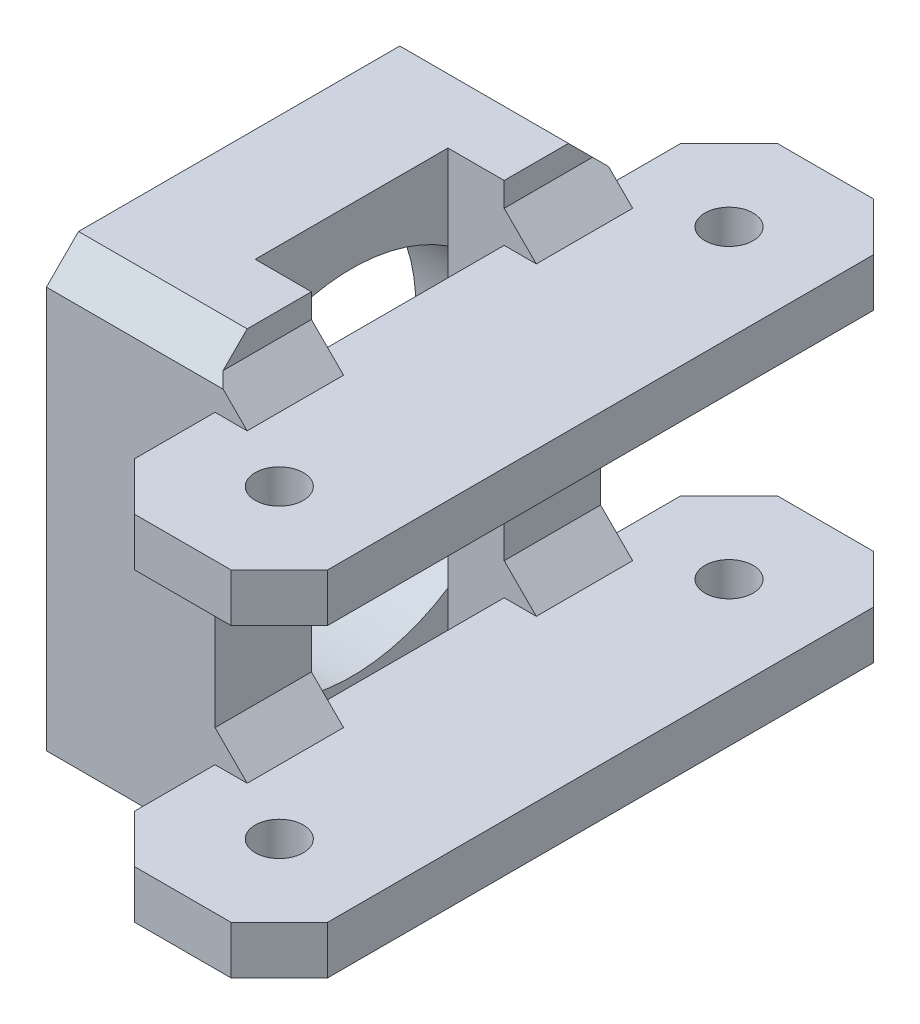
from build123d import *

# Parameters (mm, degrees)
SKETCH1_R           = 1.5
BOSS_EXTRUDE1_DEPTH = 3
BOSS_EXTRUDE2_START = 22.5
SKETCH2_W           = 3.5
SKETCH2_H           = 6
BOSS_EXTRUDE2_DEPTH = 29
CHAMFER2_SIZE       = 2
SKETCH3_W           = 24
SKETCH3_H           = 29
SKETCH3_R           = 11
BOSS_EXTRUDE4_DEPTH = 7
CHAMFER3_SIZE       = 2


# Read off the part's stored shape, not the designer's step: Mirror1
with BuildPart() as part:
    # Sketch1 → Boss-Extrude1 (new body)
    with BuildSketch(Plane(origin=(0, 0, 0), x_dir=(1, 0, 0), z_dir=(0, 1, 0))):
        Polygon((-6, 17), (-3, 20), (3, 20), (6, 17), (6, -17), (3, -20), (-3, -20), (-6, -17), align=None)
        with Locations(Location((0, 14, 0), (0, 0, 270))):
            Circle(SKETCH1_R, mode=Mode.SUBTRACT)
        with Locations(Location((0, -14, 0), (0, 0, 270))):
            Circle(SKETCH1_R, mode=Mode.SUBTRACT)
    extrude(amount=BOSS_EXTRUDE1_DEPTH)

    # Sketch2 → Boss-Extrude2 (add)
    with BuildSketch(Plane(origin=(0, 3, 0), x_dir=(1, 0, 0), z_dir=(0, 1, 0)).offset(BOSS_EXTRUDE2_START)):
        with Locations((-7.75, 9)):
            Rectangle(SKETCH2_W, SKETCH2_H)
        with Locations((-7.75, -9)):
            Rectangle(SKETCH2_W, SKETCH2_H)
    extrude(amount=-BOSS_EXTRUDE2_DEPTH)

    # Chamfer2
    chamfer2_edges = [part.edges().sort_by_distance(p)[0] for p in [
        (-6, 0, -9),
        (-6, 0, 9),
        (-6, 3, -9),
        (-6, 3, 9),
    ]]
    chamfer(chamfer2_edges, length=CHAMFER2_SIZE)

    # Sketch3 → Boss-Extrude4 (add)
    with BuildSketch(Plane.ZY.offset(9.5)):
        with Locations((0, 11)):
            Rectangle(SKETCH3_W, SKETCH3_H)
        with Locations(Location((0, 11, 0), (0, 0, 236.944268849))):
            Circle(SKETCH3_R, mode=Mode.SUBTRACT)
    extrude(amount=BOSS_EXTRUDE4_DEPTH)

    # Chamfer3
    chamfer3_edges = [part.edges().sort_by_distance(p)[0] for p in [
        (-11.25, 25.5, -12),
        (-11.25, -3.5, -12),
        (-11.25, -3.5, 12),
        (-11.25, 25.5, 12),
    ]]
    chamfer(chamfer3_edges, length=CHAMFER3_SIZE)

    # Mirror1: part across plane


with BuildPart() as part_1:
    add(part.part)
    add(part.part.mirror(Plane(origin=(0, 11, 0), x_dir=(0, 0, 1), z_dir=(0, -1, 0))))


solid = part_1.part
